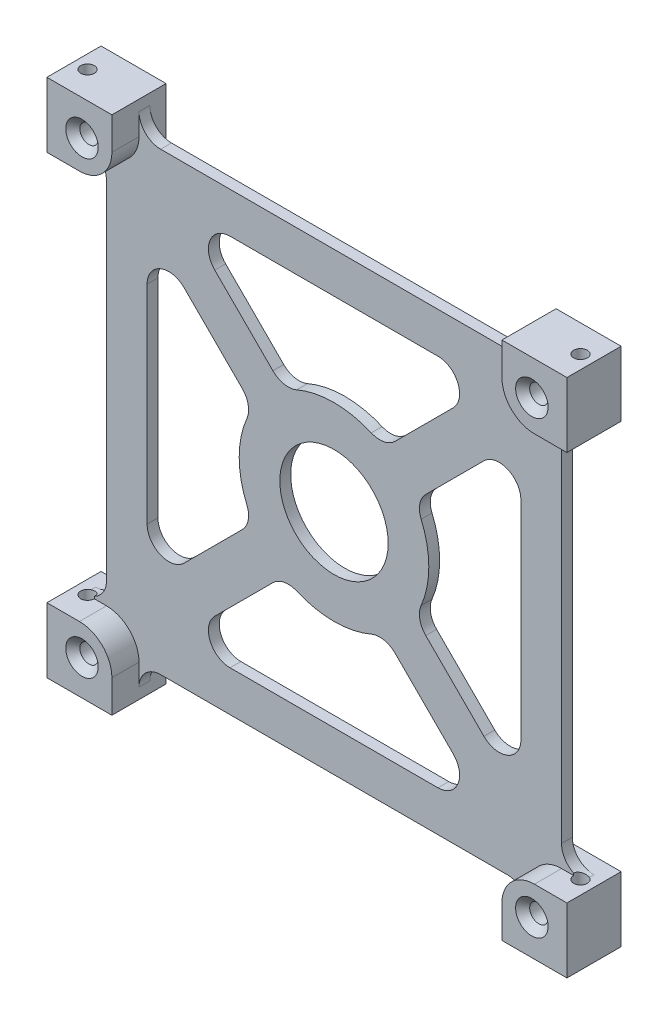
from build123d import *

# Parameters (mm, degrees)
BOTTOMLAYER_DEPTH              = 10
BOSS_EXTRUDE1_DEPTH            = 2
M3_CLEARANCE_HOLE1_D           = 3.4
M3_CLEARANCE_HOLE1_CSINK_D     = 6
M3_CLEARANCE_HOLE1_CSINK_ANGLE = 90
TAP_DRILL_FOR_M3_TAP1_D        = 2.5
CIRPATTERN2_COUNT              = 4
CIRPATTERN3_OUTLINE_R          = 1.7
CIRPATTERN3_DEPTH              = 8.6999999
CIRPATTERN3_2_OUTLINE_W        = 12
CIRPATTERN3_2_OUTLINE_H        = 12
CIRPATTERN3_2_OUTLINE_R        = 1.7
CIRPATTERN3_2_DEPTH            = 8.6999999
CIRPATTERN3_START              = -48
CIRPATTERN3_3_OUTLINE_W        = 12
CIRPATTERN3_3_OUTLINE_H        = 1.3000001
CIRPATTERN3_3_DEPTH            = 12
CIRPATTERN3_START_2            = 36
CIRPATTERN3_4_OUTLINE_W        = 12
CIRPATTERN3_4_OUTLINE_H        = 1.3000001
CIRPATTERN3_4_DEPTH            = 12
FILLET1_R                      = 4
TAP_DRILL_FOR_M3_TAP2_D        = 2.5
TAP_DRILL_FOR_M3_TAP2_DEPTH    = 12
FILLET2_R                      = 4
FILLET3_R                      = 6


with BuildPart() as part:
    # Sketch3 → BottomLayer (new body)
    with BuildSketch(Plane.XY):
        Polygon((48, 48), (36, 48), (36, 42), (36, 36), (42, 36), (48, 36), align=None)
    extrude(amount=BOTTOMLAYER_DEPTH)

    # Sketch30 → Boss-Extrude1 (add)
    with BuildSketch(Plane.XY.offset(3)):
        with BuildLine():
            Line((0, 42), (42, 42))
            Line((42, 42), (42, 0))
            Line((42, 0), (34.5, 0))
            Line((34.5, 0), (34.5, 28.843145751))
            Line((34.5, 28.843145751), (14.875210928, 9.218356678))
            ThreePointArc((14.875210928, 9.218356678), (16.831015882, 4.792379824), (17.5, 0))
            Line((17.5, 0), (10, 0))
            ThreePointArc((10, 0), (7.071067812, 7.071067812), (0, 10))
            Line((0, 10), (0, 17.5))
            ThreePointArc((0, 17.5), (4.792379824, 16.831015882), (9.218356678, 14.875210928))
            Line((9.218356678, 14.875210928), (28.843145751, 34.5))
            Line((28.843145751, 34.5), (0, 34.5))
            Line((0, 34.5), (0, 42))
        make_face()
    boss_extrude1 = extrude(amount=BOSS_EXTRUDE1_DEPTH)

    # M3 Clearance Hole1 (through all)
    with Locations(Plane.XY.offset(10)):
        with Locations((41.525, 41.525)):
            CounterSinkHole(M3_CLEARANCE_HOLE1_D / 2, M3_CLEARANCE_HOLE1_CSINK_D / 2, counter_sink_angle=M3_CLEARANCE_HOLE1_CSINK_ANGLE)

    # Tap Drill for M3 Tap1 (through all)
    with Locations(Plane(origin=(0, 48, 0), x_dir=(1, 0, 0), z_dir=(0, 1, 0))):
        with Locations((45.5, -5)):
            tap_drill_for_m3_tap1 = Hole(TAP_DRILL_FOR_M3_TAP1_D / 2)

    # CirPattern2: Boss-Extrude1 ×4 about axis
    cirpattern2_axis = Axis((0, 0, 0), (0, 0, 1))
    for i in range(1, CIRPATTERN2_COUNT):
        add(boss_extrude1.rotate(cirpattern2_axis, i * 360 / CIRPATTERN2_COUNT))

    # CirPattern3: read off the stored shape, not the designer's step
    # CirPattern3 outline → CirPattern3 (cut)
    with BuildSketch(Plane.XY):
        with Locations((-41.525, 41.525)):
            Circle(CIRPATTERN3_OUTLINE_R)
        with Locations((-41.525, -41.525)):
            Circle(CIRPATTERN3_OUTLINE_R)
        with Locations((41.525, -41.525)):
            Circle(CIRPATTERN3_OUTLINE_R)
    extrude(amount=CIRPATTERN3_DEPTH, mode=Mode.SUBTRACT)

    # CirPattern3 2 outline → CirPattern3 2 (add)
    # profile 1 of 3: a face of its own
    with BuildSketch(Plane.XY):
        with Locations((-42, 42)):
            Rectangle(CIRPATTERN3_2_OUTLINE_W, CIRPATTERN3_2_OUTLINE_H)
        with Locations((-41.525, 41.525)):
            Circle(CIRPATTERN3_2_OUTLINE_R, mode=Mode.SUBTRACT)
    # profile 2 of 3: a face of its own
    with BuildSketch(Plane.XY):
        with Locations((42, -42)):
            Rectangle(CIRPATTERN3_2_OUTLINE_W, CIRPATTERN3_2_OUTLINE_H)
        with Locations((41.525, -41.525)):
            Circle(CIRPATTERN3_2_OUTLINE_R, mode=Mode.SUBTRACT)
    # profile 3 of 3: a face of its own
    with BuildSketch(Plane.XY):
        with Locations((-42, -42)):
            Rectangle(CIRPATTERN3_2_OUTLINE_W, CIRPATTERN3_2_OUTLINE_H)
        with Locations((-41.525, -41.525)):
            Circle(CIRPATTERN3_2_OUTLINE_R, mode=Mode.SUBTRACT)
    extrude(amount=CIRPATTERN3_2_DEPTH)

    # CirPattern3 3 outline → CirPattern3 3 (add)
    with BuildSketch(Plane(origin=(0, 0, 0), x_dir=(1, 0, 0), z_dir=(0, 1, 0)).offset(CIRPATTERN3_START)):
        with Locations((42, -9.34999995)):
            Rectangle(CIRPATTERN3_3_OUTLINE_W, CIRPATTERN3_3_OUTLINE_H)
        with Locations((-42, -9.34999995)):
            Rectangle(CIRPATTERN3_3_OUTLINE_W, CIRPATTERN3_3_OUTLINE_H)
    extrude(amount=CIRPATTERN3_3_DEPTH)

    # CirPattern3 4 outline → CirPattern3 4 (add)
    with BuildSketch(Plane(origin=(0, 0, 0), x_dir=(1, 0, 0), z_dir=(0, 1, 0)).offset(CIRPATTERN3_START_2)):
        with Locations((-42, -9.34999995)):
            Rectangle(CIRPATTERN3_4_OUTLINE_W, CIRPATTERN3_4_OUTLINE_H)
    extrude(amount=CIRPATTERN3_4_DEPTH)

    # CirPattern3 5: loft between two sections, ruled curve by curve
    cirpattern3_5_from = [
        Edge.make_three_point_arc((-39.825, 41.525, 8.7), (-41.525, 43.225, 8.7), (-43.225, 41.525, 8.7)),
        Edge.make_three_point_arc((-43.225, 41.525, 8.7), (-41.525, 39.825, 8.7), (-39.825, 41.525, 8.7)),
    ]
    cirpattern3_5_to = [
        Edge.make_three_point_arc((-38.525, 41.525, 10), (-41.525, 44.525, 10), (-44.525, 41.525, 10)),
        Edge.make_three_point_arc((-44.525, 41.525, 10), (-41.525, 38.525, 10), (-38.525, 41.525, 10)),
    ]
    cirpattern3_5 = Solid(Shell([*[Face.make_surface_from_curves(cirpattern3_5_from[k], cirpattern3_5_to[k]) for k in range(2)], Face(Wire(cirpattern3_5_from)), Face(Wire(cirpattern3_5_to))]))
    add(cirpattern3_5, mode=Mode.SUBTRACT)

    # CirPattern3 6: loft between two sections, ruled curve by curve
    cirpattern3_6_from = [
        Edge.make_three_point_arc((-39.825, -41.525, 8.7), (-41.525, -39.825, 8.7), (-43.225, -41.525, 8.7)),
        Edge.make_three_point_arc((-43.225, -41.525, 8.7), (-41.525, -43.225, 8.7), (-39.825, -41.525, 8.7)),
    ]
    cirpattern3_6_to = [
        Edge.make_three_point_arc((-38.525, -41.525, 10), (-41.525, -38.525, 10), (-44.525, -41.525, 10)),
        Edge.make_three_point_arc((-44.525, -41.525, 10), (-41.525, -44.525, 10), (-38.525, -41.525, 10)),
    ]
    cirpattern3_6 = Solid(Shell([*[Face.make_surface_from_curves(cirpattern3_6_from[k], cirpattern3_6_to[k]) for k in range(2)], Face(Wire(cirpattern3_6_from)), Face(Wire(cirpattern3_6_to))]))
    add(cirpattern3_6, mode=Mode.SUBTRACT)

    # CirPattern3 7: loft between two sections, ruled curve by curve
    cirpattern3_7_from = [
        Edge.make_three_point_arc((43.225, -41.525, 8.7), (41.525, -39.825, 8.7), (39.825, -41.525, 8.7)),
        Edge.make_three_point_arc((39.825, -41.525, 8.7), (41.525, -43.225, 8.7), (43.225, -41.525, 8.7)),
    ]
    cirpattern3_7_to = [
        Edge.make_three_point_arc((44.525, -41.525, 10), (41.525, -38.525, 10), (38.525, -41.525, 10)),
        Edge.make_three_point_arc((38.525, -41.525, 10), (41.525, -44.525, 10), (44.525, -41.525, 10)),
    ]
    cirpattern3_7 = Solid(Shell([*[Face.make_surface_from_curves(cirpattern3_7_from[k], cirpattern3_7_to[k]) for k in range(2)], Face(Wire(cirpattern3_7_from)), Face(Wire(cirpattern3_7_to))]))
    add(cirpattern3_7, mode=Mode.SUBTRACT)

    # Fillet1
    fillet1_edges = [part.edges().sort_by_distance(p)[0] for p in [
        (28.843145751, 34.5, 4),
        (9.218356678, 14.875210928, 4),
        (14.875210928, 9.218356678, 4),
        (34.5, 28.843145751, 4),
        (-34.5, -28.843145751, 4),
        (-34.5, 28.843145751, 4),
        (-14.875210928, 9.218356678, 4),
        (-9.218356678, 14.875210928, 4),
        (-28.843145751, 34.5, 4),
        (28.843145751, -34.5, 4),
        (-28.843145751, -34.5, 4),
        (-9.218356678, -14.875210928, 4),
        (-14.875210928, -9.218356678, 4),
        (34.5, -28.843145751, 4),
        (14.875210928, -9.218356678, 4),
        (9.218356678, -14.875210928, 4),
    ]]
    fillet(fillet1_edges, radius=FILLET1_R)

    # Tap Drill for M3 Tap2
    with Locations(Plane(origin=(0, 48, 0), x_dir=(1, 0, 0), z_dir=(0, 1, 0))):
        with Locations((-45.5, -5)):
            tap_drill_for_m3_tap2 = Hole(TAP_DRILL_FOR_M3_TAP2_D / 2, depth=TAP_DRILL_FOR_M3_TAP2_DEPTH)

    # Mirror1: Tap Drill for M3 Tap1, Tap Drill for M3 Tap2 across plane
    add(tap_drill_for_m3_tap1.mirror(Plane.ZX), mode=Mode.SUBTRACT)
    add(tap_drill_for_m3_tap2.mirror(Plane.ZX), mode=Mode.SUBTRACT)

    # Fillet2
    # the kernel refuses this fillet: 4 mm, written as the material it adds along each edge
    with BuildSketch(Plane(origin=(-42, 36, 5), x_dir=(-1, 0, 0), z_dir=(0, 0, -1))) as fillet2_piece_1_section:
        with BuildLine():
            CenterArc((FILLET2_R, -FILLET2_R), FILLET2_R, 90, 90)
            Line((0, -FILLET2_R), (0, 0))
            Line((0, 0), (FILLET2_R, 0))
        make_face()
    fillet2_piece_1 = extrude(amount=2, mode=Mode.PRIVATE)
    fillet2_piece_1 = fillet2_piece_1 - Plane(origin=(-45.5, 36, 5), x_dir=(-1, 0, 0), z_dir=(0, -1, 0)) * Cylinder(1.25, 20, mode=Mode.PRIVATE)
    add(fillet2_piece_1)
    with BuildSketch(Plane(origin=(-36, 42, 3), x_dir=(1, 0, 0), z_dir=(0, 0, 1)), Plane(origin=(-36, -42, 5), x_dir=(1, 0, 0), z_dir=(0, 0, -1)), Plane(origin=(36, -42, 3), x_dir=(-1, 0, 0), z_dir=(0, 0, 1))) as fillet2_piece_2:
        with BuildLine():
            CenterArc((FILLET2_R, FILLET2_R), FILLET2_R, 180, 90)
            Line((0, FILLET2_R), (0, 0))
            Line((0, 0), (FILLET2_R, 0))
        make_face()
    extrude(amount=2)
    with BuildSketch(Plane(origin=(-42, -36, 3), x_dir=(0, 1, 0), z_dir=(0, 0, 1))) as fillet2_piece_3_section:
        with BuildLine():
            CenterArc((FILLET2_R, FILLET2_R), FILLET2_R, 180, 90)
            Line((0, FILLET2_R), (0, 0))
            Line((0, 0), (FILLET2_R, 0))
        make_face()
    fillet2_piece_3 = extrude(amount=2, mode=Mode.PRIVATE)
    fillet2_piece_3 = fillet2_piece_3 - Plane(origin=(-45.5, -36, 5), x_dir=(-1, 0, 0), z_dir=(0, 1, 0)) * Cylinder(1.25, 20, mode=Mode.PRIVATE)
    add(fillet2_piece_3)
    with BuildSketch(Plane(origin=(42, -36, 5), x_dir=(1, 0, 0), z_dir=(0, 0, -1))) as fillet2_piece_4_section:
        with BuildLine():
            CenterArc((FILLET2_R, -FILLET2_R), FILLET2_R, 90, 90)
            Line((0, -FILLET2_R), (0, 0))
            Line((0, 0), (FILLET2_R, 0))
        make_face()
    fillet2_piece_4 = extrude(amount=2, mode=Mode.PRIVATE)
    fillet2_piece_4 = fillet2_piece_4 - Plane(origin=(45.5, -36, 5), x_dir=(-1, 0, 0), z_dir=(0, 1, 0)) * Cylinder(1.25, 20, mode=Mode.PRIVATE)
    add(fillet2_piece_4)
    with BuildSketch(Plane(origin=(42, 36, 5), x_dir=(0, -1, 0), z_dir=(0, 0, -1))) as fillet2_piece_5_section:
        with BuildLine():
            CenterArc((FILLET2_R, -FILLET2_R), FILLET2_R, 90, 90)
            Line((0, -FILLET2_R), (0, 0))
            Line((0, 0), (FILLET2_R, 0))
        make_face()
    fillet2_piece_5 = extrude(amount=2, mode=Mode.PRIVATE)
    fillet2_piece_5 = fillet2_piece_5 - Plane(origin=(45.5, 36, 5), x_dir=(-1, 0, 0), z_dir=(0, -1, 0)) * Cylinder(1.25, 20, mode=Mode.PRIVATE)
    add(fillet2_piece_5)
    with BuildSketch(Plane(origin=(36, 42, 3), x_dir=(-1, 0, 0), z_dir=(0, 0, 1))) as fillet2_piece_6:
        with BuildLine():
            CenterArc((FILLET2_R, -FILLET2_R), FILLET2_R, 90, 90)
            Line((0, -FILLET2_R), (0, 0))
            Line((0, 0), (FILLET2_R, 0))
        make_face()
    extrude(amount=2)

    # Fillet3
    fillet3_edges = [part.edges().sort_by_distance(p)[0] for p in [
        (36, 36, 7.5),
        (-36, 36, 7.5),
        (-36, -36, 7.5),
        (36, -36, 7.5),
    ]]
    fillet(fillet3_edges, radius=FILLET3_R - 0.0001)  # a hair under: the kernel refuses the full size


solid = part.part
